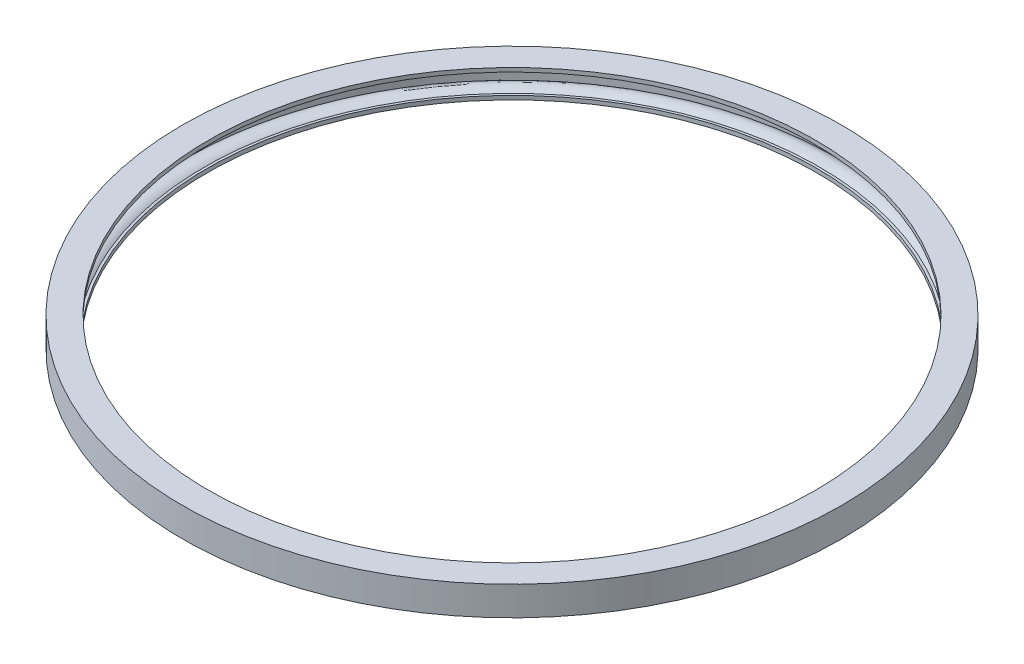
from build123d import *


with BuildPart() as part:
    # Sketch2 → Revolve1 (revolve)
    with BuildSketch(Plane(origin=(19.120852058, -245.393256526, 65.570618185), x_dir=(-0.9800835557204909, -4.980770021259261e-15, -0.1985855578995605), z_dir=(0.1985855578995605, 2.571409064264252e-15, -0.9800835557204909))):
        with BuildLine():
            ThreePointArc((-263.332584066, 5.221571347), (-258.227186422, 6.173270114), (-253.807584066, 8.900527101))
            Line((-253.807584066, 8.900527101), (-253.807584066, 7.161851411))
            Line((-253.807584066, 7.161851411), (-249.807584066, 7.161851411))
            Line((-249.807584066, 7.161851411), (-249.807584066, 11.221571347))
            Line((-249.807584066, 11.221571347), (-276.857584066, 11.221571347))
            Line((-276.857584066, 11.221571347), (-276.857584066, -18.820517146))
            Line((-276.857584066, -18.820517146), (-251.278247656, -18.820517146))
            Line((-251.278247656, -18.820517146), (-251.278247656, -14.76079721))
            Line((-251.278247656, -14.76079721), (-253.807584066, -14.76079721))
            Line((-253.807584066, -14.76079721), (-253.807584066, -16.499472899))
            ThreePointArc((-253.807584066, -16.499472899), (-258.227186422, -13.772215913), (-263.332584066, -12.820517146))
            ThreePointArc((-263.332584066, -12.820517146), (-268.437981711, -13.772215913), (-272.857584066, -16.499472899))
            Line((-272.857584066, -16.499472899), (-272.857584066, 8.900527101))
            ThreePointArc((-272.857584066, 8.900527101), (-268.437981711, 6.173270114), (-263.332584066, 5.221571347))
        make_face()
    revolve(axis=Axis((-43.303037423, -240.171685178, 52.922224232), (0, 1, 0)))


solid = part.part
